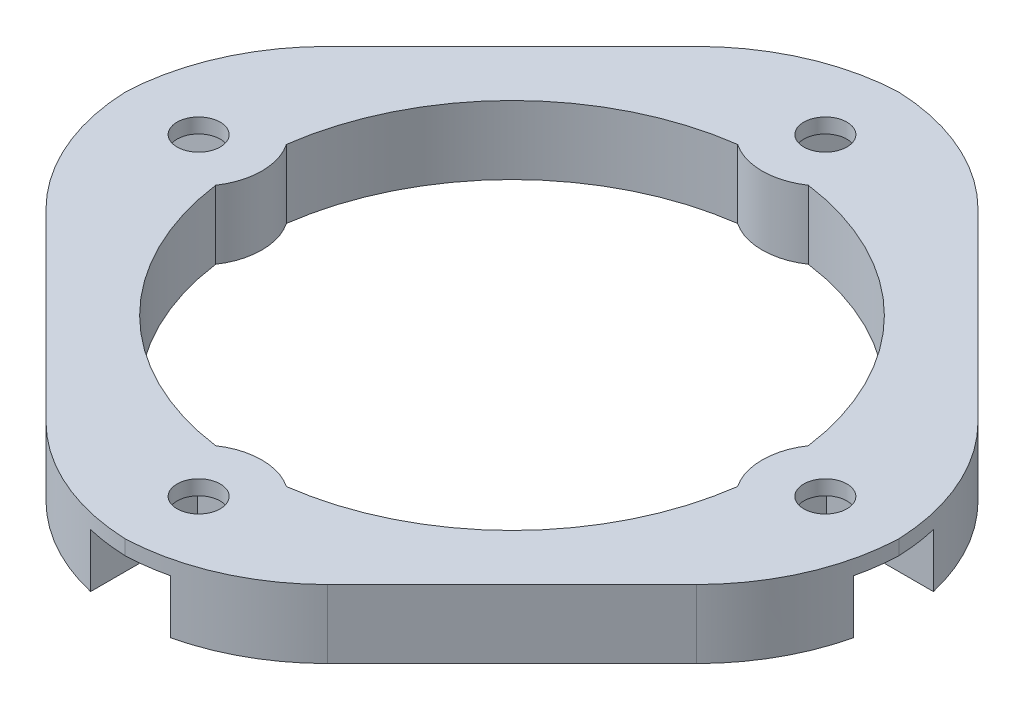
from build123d import *

# Parameters (mm, degrees)
SKETCH1_R           = 75
SKETCH1_R_2         = 50
BOSS_EXTRUDE1_DEPTH = 13
SKETCH2_R           = 4.1
CUT_EXTRUDE1_DEPTH  = 107.85972113
SKETCH8_R           = 12
SKETCH8_R_2         = 4.1
BOSS_EXTRUDE4_DEPTH = 13
SKETCH3_W           = 15.2
SKETCH3_H           = 40
SKETCH3_W_2         = 40
SKETCH3_H_2         = 15.2
CUT_EXTRUDE2_DEPTH  = 10.2
BOSS_EXTRUDE2_DEPTH = 13
FILLET1_R           = 30
SKETCH7_OUTSIDE_W   = 194.506
SKETCH7_OUTSIDE_H   = 194.506
CUT_EXTRUDE4_DEPTH  = 107.85972113
FILLET3_R           = 40


with BuildPart() as part:
    # Sketch1 → Boss-Extrude1 (new body)
    with BuildSketch(Plane(origin=(0, 0, 0), x_dir=(1, 0, 0), z_dir=(0, 1, 0))):
        with Locations(Location((0, 0, 0), (0, 0, 90))):
            Circle(SKETCH1_R)
        with Locations(Location((0, 0, 0), (0, 0, 90))):
            Circle(SKETCH1_R_2, mode=Mode.SUBTRACT)
    extrude(amount=BOSS_EXTRUDE1_DEPTH)

    # Sketch2 → Cut-Extrude1 (cut, through all)
    with BuildSketch(Plane(origin=(0, 13, 0), x_dir=(1, 0, 0), z_dir=(0, 1, 0))):
        with Locations(Location((0, 59.5, 0), (0, 0, 270))):
            Circle(SKETCH2_R)
        with Locations(Location((59.5, 0, 0), (0, 0, 270))):
            Circle(SKETCH2_R)
        with Locations(Location((0, -59.5, 0), (0, 0, 270))):
            Circle(SKETCH2_R)
        with Locations(Location((-59.5, 0, 0), (0, 0, 270))):
            Circle(SKETCH2_R)
    extrude(amount=-CUT_EXTRUDE1_DEPTH, mode=Mode.SUBTRACT)

    # Sketch8 → Boss-Extrude4 (add)
    # profile 1 of 4: a face of its own
    with BuildSketch(Plane(origin=(0, 13, 0), x_dir=(1, 0, 0), z_dir=(0, 1, 0))):
        with Locations((59.5, 0)):
            Circle(SKETCH8_R)
        with Locations(Location((59.5, 0, 0), (0, 0, 270))):
            Circle(SKETCH8_R_2, mode=Mode.SUBTRACT)
    # profile 2 of 4: a face of its own
    with BuildSketch(Plane(origin=(0, 13, 0), x_dir=(1, 0, 0), z_dir=(0, 1, 0))):
        with Locations((0, -59.5)):
            Circle(SKETCH8_R)
        with Locations(Location((0, -59.5, 0), (0, 0, 270))):
            Circle(SKETCH8_R_2, mode=Mode.SUBTRACT)
    # profile 3 of 4: a face of its own
    with BuildSketch(Plane(origin=(0, 13, 0), x_dir=(1, 0, 0), z_dir=(0, 1, 0))):
        with Locations((-59.5, 0)):
            Circle(SKETCH8_R)
        with Locations(Location((-59.5, 0, 0), (0, 0, 270))):
            Circle(SKETCH8_R_2, mode=Mode.SUBTRACT)
    # profile 4 of 4: a face of its own
    with BuildSketch(Plane(origin=(0, 13, 0), x_dir=(1, 0, 0), z_dir=(0, 1, 0))):
        with Locations((0, 59.5)):
            Circle(SKETCH8_R)
        with Locations(Location((0, 59.5, 0), (0, 0, 270))):
            Circle(SKETCH8_R_2, mode=Mode.SUBTRACT)
    extrude(amount=-BOSS_EXTRUDE4_DEPTH)

    # Sketch3 → Cut-Extrude2 (cut)
    with BuildSketch(Plane.XZ):
        with Locations((0, 72.1)):
            Rectangle(SKETCH3_W, SKETCH3_H)
        with Locations((72.1, 0)):
            Rectangle(SKETCH3_W_2, SKETCH3_H_2)
        with Locations((0, -72.1)):
            Rectangle(SKETCH3_W, SKETCH3_H)
        with Locations((-72.1, 0)):
            Rectangle(SKETCH3_W_2, SKETCH3_H_2)
    extrude(amount=-CUT_EXTRUDE2_DEPTH, mode=Mode.SUBTRACT)

    # Sketch4 → Boss-Extrude2 (add)
    with BuildSketch(Plane(origin=(0, 13, 0), x_dir=(1, 0, 0), z_dir=(0, 1, 0))):
        Polygon((-40.658639918, -65.40737726), (-65.40737726, -40.658639918), (-63.943497033, -39.194759691), (-39.194759691, -63.943497033), align=None)
    extrude(amount=-BOSS_EXTRUDE2_DEPTH)

    # Fillet1
    # the kernel refuses this fillet: 30 mm, written as the material it adds along each edge
    with BuildSketch(Plane(origin=(-63.943497033, 13, 39.194759691), x_dir=(-0.47318102872743373, 0, -0.8809652172773041), z_dir=(0, -1, 0))) as fillet1_piece_1:
        with BuildLine():
            CenterArc((10.253688675, -29.951285387), FILLET1_R, 93.265618259, 17.938271436)
            Line((-0.596947211, -1.982307914), (-0.813959928, -1.422928365))
            ThreePointArc((-0.813959928, -1.422928365), (-0.872989201, -0.818145778), (-0.574515596, 0.173008179))
            Line((-0.574515596, 0.173008179), (0.034178962, 0.599025708))
            ThreePointArc((0.034178962, 0.599025708), (4.272370281, 0.478213468), (8.5105616, 0.599025708))
            Line((8.5105616, 0.599025708), (8.544740562, 0))
        make_face()
    extrude(amount=13)
    with BuildSketch(Plane(origin=(-39.194759691, 13, 63.943497033), x_dir=(0.8809652172773019, 0, 0.47318102872743756), z_dir=(0, -1, 0))) as fillet1_piece_2:
        with BuildLine():
            CenterArc((10.253688675, 29.951285387), FILLET1_R, 248.796110305, 17.938271436)
            Line((-0.596947211, 1.982307914), (-0.813959928, 1.422928365))
            ThreePointArc((-0.813959928, 1.422928365), (-0.872989201, 0.818145778), (-0.574515596, -0.173008179))
            Line((-0.574515596, -0.173008179), (0.034178962, -0.599025708))
            ThreePointArc((0.034178962, -0.599025708), (4.272370281, -0.478213468), (8.5105616, -0.599025708))
            Line((8.5105616, -0.599025708), (8.544740562, 0))
        make_face()
    extrude(amount=13)

    # Sketch7 outside → Cut-Extrude4 (cut, through all)
    with BuildSketch(Plane(origin=(0, 13, 0), x_dir=(1, 0, 0), z_dir=(0, 1, 0))):
        Rectangle(SKETCH7_OUTSIDE_W, SKETCH7_OUTSIDE_H)
        Polygon((73.484692283, -15), (15, -73.484692283), (-15, -73.484692283), (-73.484692283, -15), (-73.484692283, 15), (-15, 73.484692283), (15, 73.484692283), (73.484692283, 15), align=None, mode=Mode.SUBTRACT)
    extrude(amount=-CUT_EXTRUDE4_DEPTH, mode=Mode.SUBTRACT)

    # Fillet3
    # the kernel refuses this fillet: 40 mm, written as the material it takes off along each edge
    with BuildSketch(Plane(origin=(15, 54.421356237, 73.484692283), x_dir=(-1, 0, 0), z_dir=(0, -1, 0)), Plane(origin=(73.484692283, 54.421356237, 15), x_dir=(-0.7071067811865474, 0, 0.7071067811865476), z_dir=(0, -1, 0))) as fillet3_piece_1:
        with BuildLine():
            CenterArc((FILLET3_R * 0.414213562373, FILLET3_R), FILLET3_R, 225, 45)
            Line((-FILLET3_R * 0.292893218813, FILLET3_R * 0.292893218813), (0, 0))
            Line((0, 0), (FILLET3_R * 0.414213562373, 0))
        make_face()
    extrude(amount=95.842712475, mode=Mode.SUBTRACT)
    with BuildSketch(Plane(origin=(-15, 54.421356237, 73.484692283), x_dir=(1, 0, 0), z_dir=(0, -1, 0)), Plane(origin=(-73.484692283, 54.421356237, 15), x_dir=(0.7071067811865477, 0, 0.7071067811865472), z_dir=(0, -1, 0)), Plane(origin=(-73.484692283, 54.421356237, -15), x_dir=(0, 0, 1), z_dir=(0, -1, 0)), Plane(origin=(-15, 54.421356237, -73.484692283), x_dir=(-0.7071067811865472, 0, 0.7071067811865477), z_dir=(0, -1, 0)), Plane(origin=(15, 54.421356237, -73.484692283), x_dir=(-1, 0, 0), z_dir=(0, -1, 0)), Plane(origin=(73.484692283, 54.421356237, -15), x_dir=(-0.7071067811865477, 0, -0.7071067811865472), z_dir=(0, -1, 0))) as fillet3_piece_2:
        with BuildLine():
            CenterArc((FILLET3_R * 0.414213562373, -FILLET3_R), FILLET3_R, 90, 45)
            Line((-FILLET3_R * 0.292893218813, -FILLET3_R * 0.292893218813), (0, 0))
            Line((0, 0), (FILLET3_R * 0.414213562373, 0))
        make_face()
    extrude(amount=95.842712475, mode=Mode.SUBTRACT)


solid = part.part
